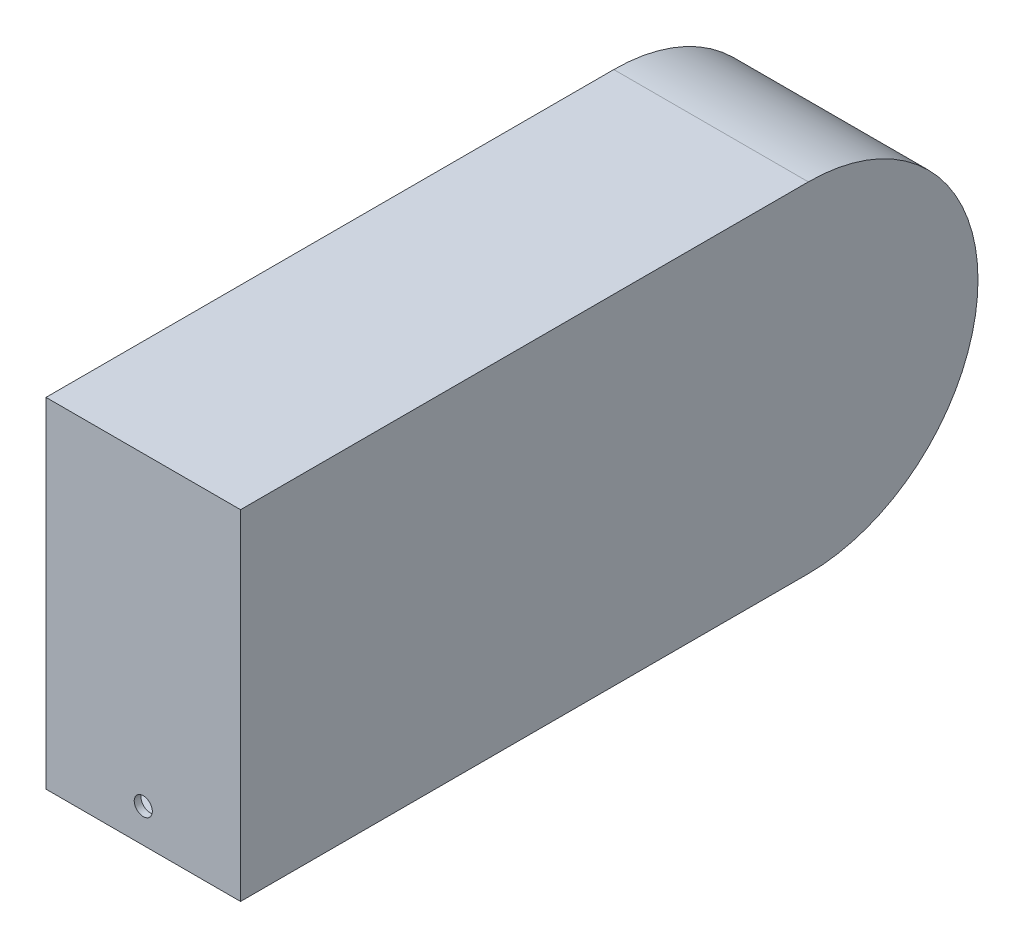
from build123d import *

# Parameters (mm, degrees)
BOSS_EXTRUDE1_DEPTH      = 63.5
BOSS_EXTRUDE1_DEPTH_BACK = 63.5
CUT_EXTRUDE1_REACH       = 573.246
SKETCH4_R                = 6.35
BOSS_EXTRUDE3_DEPTH      = 4.7625


with BuildPart() as part:
    # Sketch2 → Boss-Extrude1 (new, two sides: drawn at the far end of the back side and taken through both)
    with BuildSketch(Plane(origin=(0, 0, 0), x_dir=(0, 0, -1), z_dir=(1, 0, 0)).offset(-BOSS_EXTRUDE1_DEPTH_BACK)):
        with BuildLine():
            Line((0, -4.7625), (-398.4625, -4.7625))
            Line((-398.4625, -4.7625), (-398.4625, 233.3625))
            Line((-398.4625, 233.3625), (0, 233.3625))
            ThreePointArc((0, 233.3625), (119.0625, 114.3), (0, -4.7625))
        make_face()
        with BuildLine():
            Line((0, 0), (-393.7, 0))
            Line((-393.7, 0), (-393.7, 228.6))
            Line((-393.7, 228.6), (0, 228.6))
            ThreePointArc((0, 228.6), (114.3, 114.3), (0, 0))
        make_face(mode=Mode.SUBTRACT)
    extrude(amount=BOSS_EXTRUDE1_DEPTH + BOSS_EXTRUDE1_DEPTH_BACK)

    # Sketch4 → Cut-Extrude1 (cut, up to next)
    with BuildSketch(Plane.XY.offset(398.4625), mode=Mode.PRIVATE) as cut_extrude1_sk1:
        with Locations((0, 19.05)):
            Circle(SKETCH4_R)
    cut_extrude1_tool1 = extrude(cut_extrude1_sk1.sketch, amount=-CUT_EXTRUDE1_REACH, mode=Mode.PRIVATE) & part.part
    add(cut_extrude1_tool1.solids().sort_by_distance((0, 19.05, 398.4625))[0], mode=Mode.SUBTRACT)

    # Sketch9 → Boss-Extrude3 (add)
    with BuildSketch(Plane(origin=(63.5, 0, 0), x_dir=(0, 0, -1), z_dir=(1, 0, 0))):
        with BuildLine():
            Line((-398.4625, 233.3625), (0, 233.3625))
            ThreePointArc((0, 233.3625), (119.0625, 114.3), (0, -4.7625))
            Line((0, -4.7625), (-398.4625, -4.7625))
            Line((-398.4625, -4.7625), (-398.4625, 233.3625))
        make_face()
    boss_extrude3 = extrude(amount=BOSS_EXTRUDE3_DEPTH)

    # Mirror1: Boss-Extrude3 across plane
    add(boss_extrude3.mirror(Plane(origin=(0, 0, 0), x_dir=(0, 0, 1), z_dir=(1, 0, 0))))


solid = part.part
